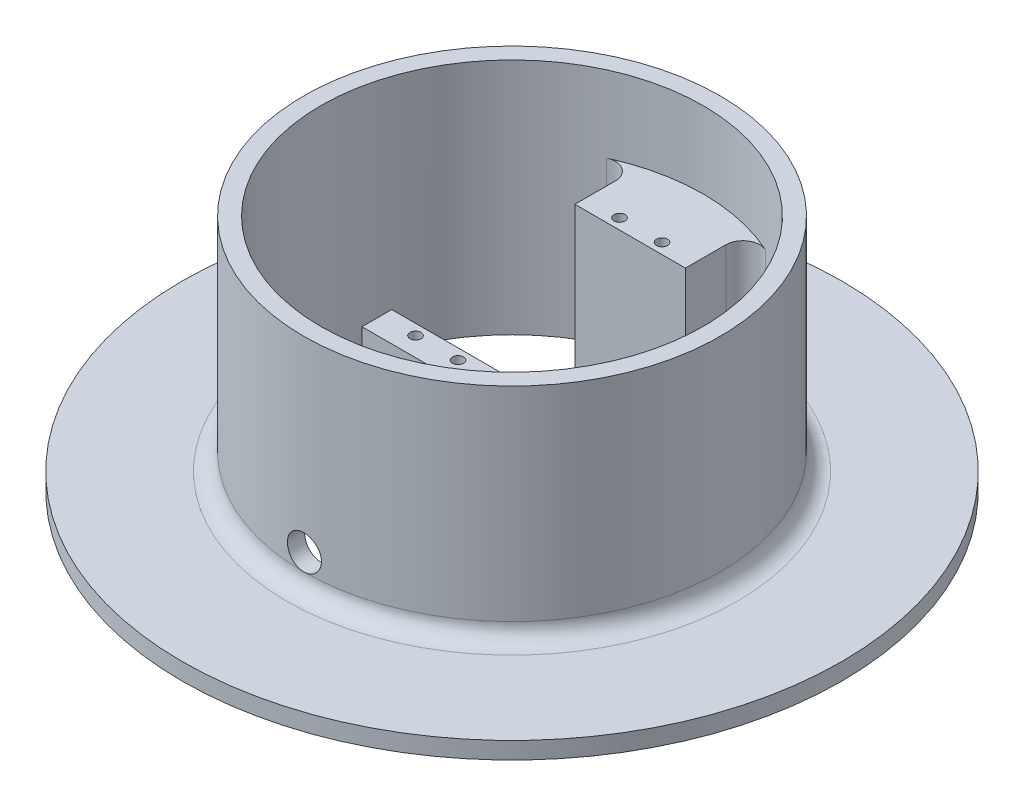
from build123d import *

# Parameters (mm, degrees)
CROQUIS3_R              = 49
CROQUIS3_R_2            = 45
SALIENTE_EXTRUIR1_DEPTH = 56
CROQUIS1_R              = 77.574507489
SALIENTE_EXTRUIR2_DEPTH = 4
SALIENTE_EXTRUIR3_DEPTH = 38
CORTAR_EXTRUIR1_DEPTH   = 8
CROQUIS7_R              = 4
CORTAR_EXTRUIR2_DEPTH   = 42
REDONDEO1_R             = 4
REDONDEO2_R             = 1
CROQUIS8_R              = 1.3
CORTAR_EXTRUIR3_DEPTH   = 30.8


with BuildPart() as part:
    # Croquis3 → Saliente-Extruir1 (new body)
    with BuildSketch(Plane(origin=(0, 0, 0), x_dir=(1, 0, 0), z_dir=(0, 1, 0))):
        with Locations(Location((0, 0, 0), (0, 0, 270))):
            Circle(CROQUIS3_R)
        with Locations(Location((0, 0, 0), (0, 0, 270))):
            Circle(CROQUIS3_R_2, mode=Mode.SUBTRACT)
    extrude(amount=SALIENTE_EXTRUIR1_DEPTH)

    # Croquis1 → Saliente-Extruir2 (add)
    with BuildSketch(Plane(origin=(0, 0, 0), x_dir=(1, 0, 0), z_dir=(0, 1, 0))):
        with Locations(Location((0, 0, 0), (0, 0, 270))):
            Circle(CROQUIS1_R)
        with BuildLine():
            Line((-23.917575663, -38.117575663), (-10, -24.2))
            Line((-10, -24.2), (0, -24.2))
            Line((0, -24.2), (10, -24.2))
            Line((10, -24.2), (23.917575663, -38.117575663))
            ThreePointArc((23.917575663, -38.117575663), (12.444056717, -43.245178372), (0, -45))
            ThreePointArc((0, -45), (-6.760954384, -44.489206509), (-13.368422036, -42.968422036))
            ThreePointArc((-13.368422036, -42.968422036), (-15.776603613, -42.143786949), (-18.134305032, -41.184305032))
            ThreePointArc((-18.134305032, -41.184305032), (-21.081778264, -39.756240079), (-23.917575663, -38.117575663))
        make_face(mode=Mode.SUBTRACT)
        with BuildLine():
            Line((13.1, -15.2), (0, -15.2))
            Line((0, -15.2), (-13.1, -15.2))
            Line((-13.1, -15.2), (-30.752476319, -32.852476319))
            ThreePointArc((-30.752476319, -32.852476319), (-7.771708829, 44.323814613), (40.095012748, -20.430123659))
            ThreePointArc((40.095012748, -20.430123659), (37.628495356, -24.679877173), (34.713332708, -28.635372048))
            ThreePointArc((34.713332708, -28.635372048), (32.8007474, -30.807644668), (30.752476319, -32.852476319))
            Line((30.752476319, -32.852476319), (13.1, -15.2))
        make_face(mode=Mode.SUBTRACT)
    extrude(amount=SALIENTE_EXTRUIR2_DEPTH)

    # Croquis5 → Saliente-Extruir3 (add)
    with BuildSketch(Plane(origin=(0, 0, 0), x_dir=(1, 0, 0), z_dir=(0, 1, 0))):
        with BuildLine():
            ThreePointArc((18.658536585, 40.949469014), (14.835992877, 40.673601998), (13, 37.309516212))
            Line((13, 37.309516212), (13, 27.8))
            Line((13, 27.8), (0, 27.8))
            Line((0, 27.8), (-13, 27.8))
            Line((-13, 27.8), (-13, 37.309516212))
            ThreePointArc((-13, 37.309516212), (-14.835992877, 40.673601998), (-18.658536585, 40.949469014))
            ThreePointArc((-18.658536585, 40.949469014), (0, 45), (18.658536585, 40.949469014))
        make_face()
        Polygon((-13.1, -15.2), (13.1, -15.2), (13, -22.2), (-13.1, -22.2), align=None)
    extrude(amount=SALIENTE_EXTRUIR3_DEPTH)

    # Croquis6 → Cortar-Extruir1 (cut)
    with BuildSketch(Plane.XY.offset(15)):
        Polygon((5, 5), (0, 5), (-5, 5), (-5, 29), (-2.492829293, 29), (5, 29), align=None)
    extrude(amount=CORTAR_EXTRUIR1_DEPTH, mode=Mode.SUBTRACT)

    # Croquis7 → Cortar-Extruir2 (cut)
    with BuildSketch(Plane.XY.offset(15)):
        with Locations(Location((0, 12, 0), (0, 0, 180))):
            Circle(CROQUIS7_R)
    extrude(amount=CORTAR_EXTRUIR2_DEPTH, mode=Mode.SUBTRACT)

    # Redondeo1
    redondeo1_edges = [part.edges().sort_by_distance(p)[0] for p in [
        (0, 4, -49),
    ]]
    fillet(redondeo1_edges, radius=REDONDEO1_R)

    # Redondeo2
    # the kernel refuses this fillet: 1 mm, written as the material it adds along each edge
    with BuildSketch(Plane(origin=(-13.1, 4, 22.2), x_dir=(0, 0, 1), z_dir=(1, 0, 0))) as redondeo2_piece_1_section:
        with BuildLine():
            CenterArc((REDONDEO2_R, -REDONDEO2_R), REDONDEO2_R, 90, 90)
            Line((0, -REDONDEO2_R), (0, 0))
            Line((0, 0), (REDONDEO2_R, 0))
        make_face()
    redondeo2_piece_1 = extrude(amount=28.6, mode=Mode.PRIVATE)
    redondeo2_piece_1 = split(redondeo2_piece_1, bisect_by=Plane(origin=(12.992267362, 4.226395114, 22.741284648), z_dir=(-0.99989797479951, 0, -0.014284256782850096)), keep=Keep.TOP, mode=Mode.PRIVATE)
    add(redondeo2_piece_1)
    with BuildSketch(Plane(origin=(12.964289358, 4, 24.699744937), x_dir=(0.99989797479951, 0, 0.014284256782850096), z_dir=(0.014284256782850096, 0, -0.99989797479951))) as redondeo2_piece_2_section:
        with BuildLine():
            CenterArc((REDONDEO2_R, -REDONDEO2_R), REDONDEO2_R, 90, 90)
            Line((0, -REDONDEO2_R), (0, 0))
            Line((0, 0), (REDONDEO2_R, 0))
        make_face()
    redondeo2_piece_2 = extrude(amount=12.000714249, mode=Mode.PRIVATE)
    redondeo2_piece_2 = split(redondeo2_piece_2, bisect_by=Plane(origin=(14.988415496, 4.230359827, 17.088415496), z_dir=(-0.7071067811865411, 0, 0.7071067811865539)), keep=Keep.TOP, mode=Mode.PRIVATE)
    redondeo2_piece_2 = split(redondeo2_piece_2, bisect_by=Plane(origin=(13.268129446, 4.230359827, 15.2), z_dir=(0, 0, 1)), keep=Keep.TOP, mode=Mode.PRIVATE)
    redondeo2_piece_2 = split(redondeo2_piece_2, bisect_by=Plane(origin=(13.268129446, 4.230359827, 22.2), z_dir=(0, 0, -1)), keep=Keep.TOP, mode=Mode.PRIVATE)
    add(redondeo2_piece_2)
    with BuildSketch(Plane(origin=(-13.1, 4, 15.2), x_dir=(-1, 0, 0), z_dir=(0, 0, 1))) as redondeo2_piece_3_section:
        with BuildLine():
            CenterArc((REDONDEO2_R, -REDONDEO2_R), REDONDEO2_R, 90, 90)
            Line((0, -REDONDEO2_R), (0, 0))
            Line((0, 0), (REDONDEO2_R, 0))
        make_face()
    redondeo2_piece_3 = extrude(amount=7, mode=Mode.PRIVATE)
    redondeo2_piece_3 = split(redondeo2_piece_3, bisect_by=Plane(origin=(-15.014877598, 4.230417942, 17.114877598), z_dir=(0.7071067811865538, 0, 0.7071067811865414)), keep=Keep.TOP, mode=Mode.PRIVATE)
    add(redondeo2_piece_3)
    with BuildSketch(Plane(origin=(-13.1, 4, 15.2), x_dir=(-1, 0, 0), z_dir=(0, 0, 1))) as redondeo2_piece_4a_section:
        with BuildLine():
            CenterArc((REDONDEO2_R, -REDONDEO2_R), REDONDEO2_R, 90, 90)
            Line((0, -REDONDEO2_R), (0, 0))
            Line((0, 0), (REDONDEO2_R, 0))
        make_face()
    redondeo2_piece_4a = extrude(amount=9.5, mode=Mode.PRIVATE)
    redondeo2_piece_4a = split(redondeo2_piece_4a, bisect_by=Plane(origin=(-13.326395114, 4.226395114, 22.2), z_dir=(0, 0, 1)), keep=Keep.TOP, mode=Mode.PRIVATE)
    with BuildSketch(Plane(origin=(-15.6, 4, 22.2), x_dir=(0, 0, 1), z_dir=(1, 0, 0))) as redondeo2_piece_4b_section:
        with BuildLine():
            CenterArc((REDONDEO2_R, -REDONDEO2_R), REDONDEO2_R, 90, 90)
            Line((0, -REDONDEO2_R), (0, 0))
            Line((0, 0), (REDONDEO2_R, 0))
        make_face()
    redondeo2_piece_4b = extrude(amount=31.1, mode=Mode.PRIVATE)
    redondeo2_piece_4b = split(redondeo2_piece_4b, bisect_by=Plane(origin=(-13.1, 4.226395114, 22.426395114), z_dir=(-1, 0, 0)), keep=Keep.TOP, mode=Mode.PRIVATE)
    redondeo2_piece_4 = redondeo2_piece_4a & redondeo2_piece_4b
    add(redondeo2_piece_4)
    with BuildSketch(Plane(origin=(-13.1, 4, 22.2), x_dir=(0, 0, 1), z_dir=(1, 0, 0))) as redondeo2_piece_5a_section:
        with BuildLine():
            CenterArc((REDONDEO2_R, -REDONDEO2_R), REDONDEO2_R, 90, 90)
            Line((0, -REDONDEO2_R), (0, 0))
            Line((0, 0), (REDONDEO2_R, 0))
        make_face()
    redondeo2_piece_5a = extrude(amount=28.6, mode=Mode.PRIVATE)
    redondeo2_piece_5a = split(redondeo2_piece_5a, bisect_by=Plane(origin=(12.997017375, 4.226238422, 22.408783729), z_dir=(0.99989797479951, 0, 0.014284256782850096)), keep=Keep.TOP, mode=Mode.PRIVATE)
    with BuildSketch(Plane(origin=(12.964289358, 4, 24.699744937), x_dir=(0.99989797479951, 0, 0.014284256782850096), z_dir=(0.014284256782850096, 0, -0.99989797479951))) as redondeo2_piece_5b_section:
        with BuildLine():
            CenterArc((REDONDEO2_R, -REDONDEO2_R), REDONDEO2_R, 90, 90)
            Line((0, -REDONDEO2_R), (0, 0))
            Line((0, 0), (REDONDEO2_R, 0))
        make_face()
    redondeo2_piece_5b = extrude(amount=12.000714249, mode=Mode.PRIVATE)
    redondeo2_piece_5b = split(redondeo2_piece_5b, bisect_by=Plane(origin=(13.208805032, 4.226238422, 22.2), z_dir=(0, 0, 1)), keep=Keep.TOP, mode=Mode.PRIVATE)
    redondeo2_piece_5 = redondeo2_piece_5a & redondeo2_piece_5b
    add(redondeo2_piece_5)

    # Croquis8 → Cortar-Extruir3 (cut)
    with BuildSketch(Plane(origin=(0, 60, 0), x_dir=(1, 0, 0), z_dir=(0, 1, 0))):
        with Locations(Location((-5, -17.7, 0), (0, 0, 270))):
            Circle(CROQUIS8_R)
        with Locations(Location((5, -17.7, 0), (0, 0, 270))):
            Circle(CROQUIS8_R)
        with Locations(Location((5, 30.3, 0), (0, 0, 270))):
            Circle(CROQUIS8_R)
        with Locations(Location((-5, 30.3, 0), (0, 0, 270))):
            Circle(CROQUIS8_R)
    extrude(amount=-CORTAR_EXTRUIR3_DEPTH, mode=Mode.SUBTRACT)


solid = part.part
